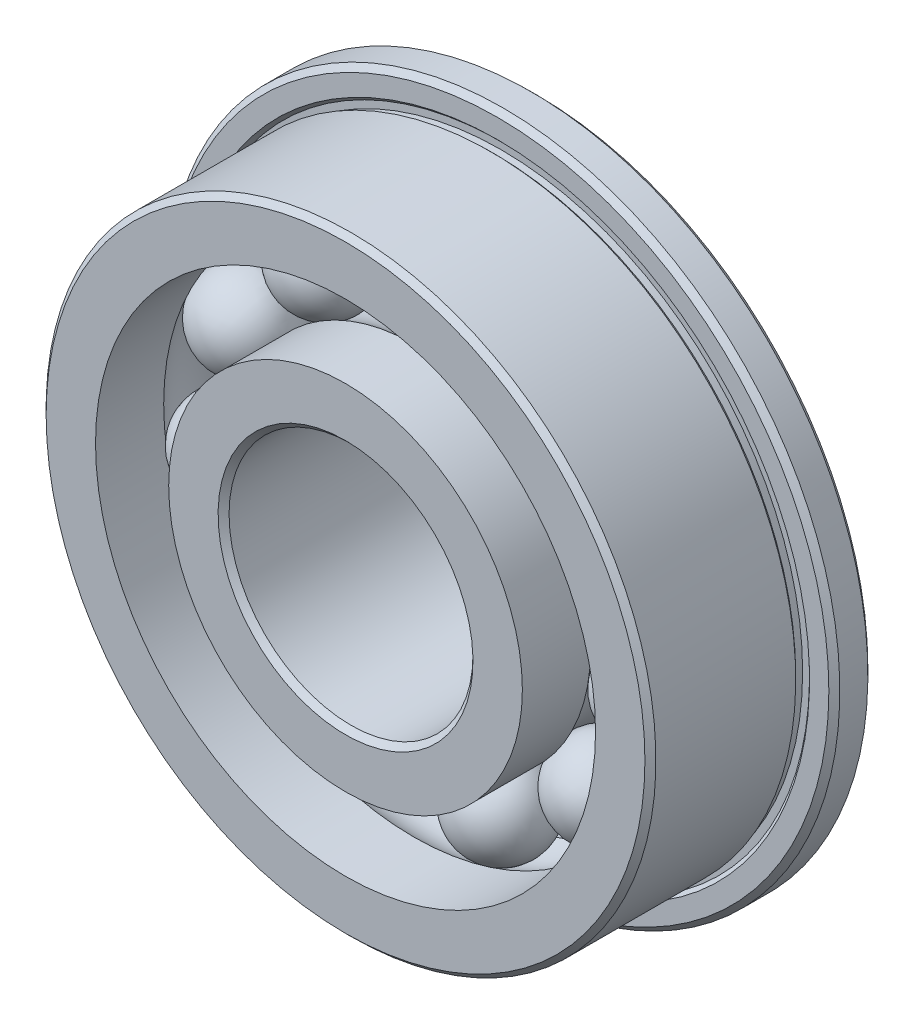
from build123d import *

# Parameters (mm, degrees)
FILLET1_SIZE      = 0.142875
FILLET2_SIZE      = 0.142875
CIRPATTERN3_COUNT = 11


with BuildPart() as part:
    # Sketch2 → Revolve1 (revolve)
    with BuildSketch(Plane(origin=(0, 0, 0), x_dir=(0, 0, -1), z_dir=(1, 0, 0))):
        with BuildLine():
            Line((2.4892, 8.763), (1.4732, 8.763))
            Line((1.4732, 8.763), (1.4732, 8.117105122))
            Line((1.4732, 8.117105122), (1.563002561, 8.027302561))
            Line((1.563002561, 8.027302561), (1.563002561, 7.847697439))
            Line((1.563002561, 7.847697439), (1.383397439, 7.847697439))
            Line((1.383397439, 7.847697439), (1.293594878, 7.9375))
            Line((1.293594878, 7.9375), (-2.4892, 7.9375))
            Line((-2.4892, 7.9375), (-2.4892, 6.50875))
            Line((-2.4892, 6.50875), (-0.714375, 6.50875))
            ThreePointArc((-0.714375, 6.50875), (0, 6.746875), (0.714375, 6.50875))
            Line((0.714375, 6.50875), (2.4892, 6.50875))
            Line((2.4892, 6.50875), (2.4892, 8.763))
        make_face()
        with BuildLine():
            Line((2.4892, 3.175), (-2.4892, 3.175))
            Line((-2.4892, 3.175), (-2.4892, 4.60375))
            Line((-2.4892, 4.60375), (-0.714375, 4.60375))
            ThreePointArc((-0.714375, 4.60375), (0, 4.365625), (0.714375, 4.60375))
            Line((0.714375, 4.60375), (2.4892, 4.60375))
            Line((2.4892, 4.60375), (2.4892, 3.175))
        make_face()
    revolve(axis=Axis((0, 0, 0), (0, 0, -1)))

    # Fillet1
    fillet1_edges = [part.edges().sort_by_distance(p)[0] for p in [
        (0, -8.763, -2.4892),
        (0, -8.763, -1.4732),
        (0, -7.9375, 2.4892),
    ]]
    chamfer(fillet1_edges, length=FILLET1_SIZE)

    # Fillet2
    fillet2_edges = [part.edges().sort_by_distance(p)[0] for p in [
        (0, -3.175, -2.4892),
        (0, -3.175, 2.4892),
    ]]
    chamfer(fillet2_edges, length=FILLET2_SIZE)


with BuildPart() as body_2:
    # Sketch7 → Revolve3 (revolve)
    with BuildSketch(Plane.XY):
        with BuildLine():
            Line((0, 6.746875), (0, 4.365625))
            ThreePointArc((0, 4.365625), (-1.190625, 5.55625), (0, 6.746875))
        make_face()
    revolve(axis=Axis((0, 6.746875, 0), (0, -1, 0)))


with BuildPart() as cirpattern3_1:
    # CirPattern3: pattern copy
    add(body_2.part.rotate(Axis((0, 0, 0), (0, 0, -1)), 1 * 360 / CIRPATTERN3_COUNT))


with BuildPart() as cirpattern3_2:
    # CirPattern3: pattern copy
    add(body_2.part.rotate(Axis((0, 0, 0), (0, 0, -1)), 2 * 360 / CIRPATTERN3_COUNT))


with BuildPart() as cirpattern3_3:
    # CirPattern3: pattern copy
    add(body_2.part.rotate(Axis((0, 0, 0), (0, 0, -1)), 3 * 360 / CIRPATTERN3_COUNT))


with BuildPart() as cirpattern3_4:
    # CirPattern3: pattern copy
    add(body_2.part.rotate(Axis((0, 0, 0), (0, 0, -1)), 4 * 360 / CIRPATTERN3_COUNT))


with BuildPart() as cirpattern3_5:
    # CirPattern3: pattern copy
    add(body_2.part.rotate(Axis((0, 0, 0), (0, 0, -1)), 5 * 360 / CIRPATTERN3_COUNT))


with BuildPart() as cirpattern3_6:
    # CirPattern3: pattern copy
    add(body_2.part.rotate(Axis((0, 0, 0), (0, 0, -1)), 6 * 360 / CIRPATTERN3_COUNT))


with BuildPart() as cirpattern3_7:
    # CirPattern3: pattern copy
    add(body_2.part.rotate(Axis((0, 0, 0), (0, 0, -1)), 7 * 360 / CIRPATTERN3_COUNT))


with BuildPart() as cirpattern3_8:
    # CirPattern3: pattern copy
    add(body_2.part.rotate(Axis((0, 0, 0), (0, 0, -1)), 8 * 360 / CIRPATTERN3_COUNT))


with BuildPart() as cirpattern3_9:
    # CirPattern3: pattern copy
    add(body_2.part.rotate(Axis((0, 0, 0), (0, 0, -1)), 9 * 360 / CIRPATTERN3_COUNT))


with BuildPart() as cirpattern3_10:
    # CirPattern3: pattern copy
    add(body_2.part.rotate(Axis((0, 0, 0), (0, 0, -1)), 10 * 360 / CIRPATTERN3_COUNT))


solid = Compound([part.part, body_2.part, cirpattern3_1.part, cirpattern3_2.part, cirpattern3_3.part, cirpattern3_4.part, cirpattern3_5.part, cirpattern3_6.part, cirpattern3_7.part, cirpattern3_8.part, cirpattern3_9.part, cirpattern3_10.part])
